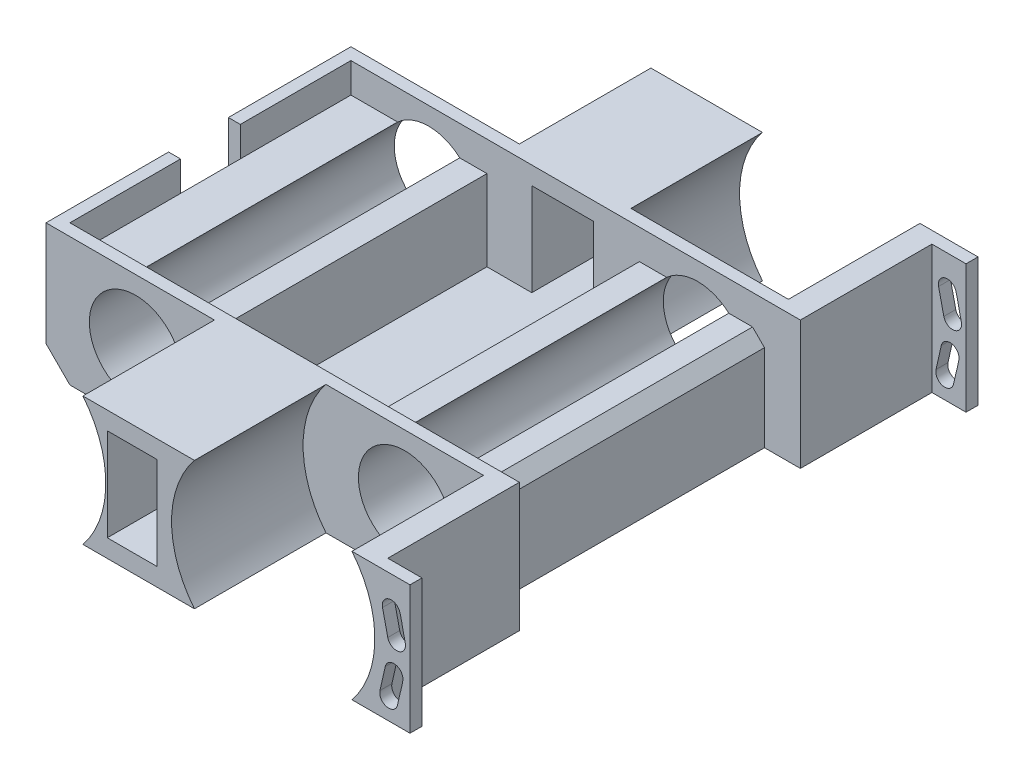
from build123d import *

# Parameters (mm, degrees)
SKETCH1_W           = 95
SKETCH1_H           = 95
BOSS_EXTRUDE1_DEPTH = 25
SKETCH2_R           = 7.75
CUT_EXTRUDE2_DEPTH  = 100
SKETCH3_R           = 17
CUT_EXTRUDE3_DEPTH  = 22
CUT_EXTRUDE4_START  = -22
SKETCH4_R           = 17
CUT_EXTRUDE4_DEPTH  = 22
SKETCH5_W           = 6.246993927
SKETCH5_H           = 25
CUT_EXTRUDE5_DEPTH  = 22
SKETCH6_W           = 7.178723585
SKETCH6_H           = 25
CUT_EXTRUDE6_DEPTH  = 22
SKETCH8_W           = 99.503929421
SKETCH8_H           = 3.5
CUT_EXTRUDE7_DEPTH  = 100
SKETCH9_W           = 8.3
SKETCH9_H           = 15.5
CUT_EXTRUDE11_DEPTH = 100
SKETCH13_W          = 87
SKETCH13_H          = 15.5
CUT_EXTRUDE12_DEPTH = 2
SKETCH14_W          = 25.5
SKETCH14_H          = 47
CUT_EXTRUDE14_DEPTH = 18.5
SKETCH16_W          = 24.75
SKETCH16_H          = 47
CUT_EXTRUDE15_DEPTH = 5
SKETCH17_W          = 20.919567191
SKETCH17_H          = 47
CUT_EXTRUDE16_DEPTH = 5
CUT_EXTRUDE17_DEPTH = 100
FILLET6_R           = 1.5
FILLET7_R           = 1.5
FILLET8_R           = 1.5
FILLET9_R           = 1.5
SKETCH19_W          = 12.12120401
SKETCH19_H          = 21.5
CUT_EXTRUDE20_DEPTH = 100
SKETCH20_W          = 5.709228799
SKETCH20_H          = 91
CUT_EXTRUDE23_DEPTH = 100
SKETCH21_W          = 6
SKETCH21_H          = 47
CUT_EXTRUDE26_DEPTH = 40
CHAMFER1_SIZE       = 2
SKETCH22_W          = 15
SKETCH22_H          = 10
CUT_EXTRUDE27_DEPTH = 4
SKETCH23_W          = 2
SKETCH23_H          = 10
CUT_EXTRUDE28_DEPTH = 54
CHAMFER2_SIZE       = 2
CHAMFER3_SIZE       = 4
CHAMFER4_SIZE       = 4
CUT_EXTRUDE29_DEPTH = 100


with BuildPart() as part:
    # Sketch1 → Boss-Extrude1 (new body)
    with BuildSketch(Plane(origin=(0, 0, 0), x_dir=(1, 0, 0), z_dir=(0, 1, 0))):
        with Locations((3.271948822, -17.506298191)):
            Rectangle(SKETCH1_W, SKETCH1_H)
    extrude(amount=BOSS_EXTRUDE1_DEPTH)

    # Sketch2 → Cut-Extrude2 (cut)
    with BuildSketch(Plane.XY.offset(65.006298191)):
        with Locations((-29.228051178, 10.75)):
            Circle(SKETCH2_R)
        with Locations((15.771948822, 10.75)):
            Circle(SKETCH2_R)
    extrude(amount=-CUT_EXTRUDE2_DEPTH, mode=Mode.SUBTRACT)

    # Sketch3 → Cut-Extrude3 (cut)
    with BuildSketch(Plane.XY.offset(65.006298191)):
        with Locations((-29.228051178, 10.75)):
            Circle(SKETCH3_R)
        with Locations((15.771948822, 10.75)):
            Circle(SKETCH3_R)
    extrude(amount=-CUT_EXTRUDE3_DEPTH, mode=Mode.SUBTRACT)

    # Sketch4 → Cut-Extrude4 (cut)
    with BuildSketch(Plane(origin=(0, 0, -29.993701809), x_dir=(-1, 0, 0), z_dir=(0, 0, -1)).offset(CUT_EXTRUDE4_START)):
        with Locations((-15.771948822, 10.75)):
            Circle(SKETCH4_R)
        with Locations((29.228051178, 10.75)):
            Circle(SKETCH4_R)
    extrude(amount=CUT_EXTRUDE4_DEPTH, mode=Mode.SUBTRACT)

    # Sketch5 → Cut-Extrude5 (cut)
    with BuildSketch(Plane.XY.offset(65.006298191)):
        with Locations((-41.104554214, 12.5)):
            Rectangle(SKETCH5_W, SKETCH5_H)
    extrude(amount=-CUT_EXTRUDE5_DEPTH, mode=Mode.SUBTRACT)

    # Sketch6 → Cut-Extrude6 (cut)
    with BuildSketch(Plane(origin=(0, 0, -29.993701809), x_dir=(-1, 0, 0), z_dir=(0, 0, -1))):
        with Locations((40.638689386, 12.5)):
            Rectangle(SKETCH6_W, SKETCH6_H)
    extrude(amount=-CUT_EXTRUDE6_DEPTH, mode=Mode.SUBTRACT)

    # Sketch8 → Cut-Extrude7 (cut)
    with BuildSketch(Plane(origin=(0, 0, -29.993701809), x_dir=(-1, 0, 0), z_dir=(0, 0, -1))):
        with Locations((-1.019984112, 23.25)):
            Rectangle(SKETCH8_W, SKETCH8_H)
    extrude(amount=-CUT_EXTRUDE7_DEPTH, mode=Mode.SUBTRACT)

    # Sketch9 → Cut-Extrude11 (cut)
    with BuildSketch(Plane.XY.offset(65.006298191)):
        with Locations((-7.828051178, 10.75)):
            Rectangle(SKETCH9_W, SKETCH9_H)
    extrude(amount=-CUT_EXTRUDE11_DEPTH, mode=Mode.SUBTRACT)

    # Sketch13 → Cut-Extrude12 (cut)
    with BuildSketch(Plane.ZY.offset(3.678051178)):
        with Locations((17.506298191, 10.75)):
            Rectangle(SKETCH13_W, SKETCH13_H)
    extrude(amount=-CUT_EXTRUDE12_DEPTH, mode=Mode.SUBTRACT)

    # Sketch14 → Cut-Extrude14 (cut)
    with BuildSketch(Plane(origin=(0, 21.5, 0), x_dir=(1, 0, 0), z_dir=(0, 1, 0))):
        with Locations((-6.728051178, -17.506298191)):
            Rectangle(SKETCH14_W, SKETCH14_H)
    extrude(amount=-CUT_EXTRUDE14_DEPTH, mode=Mode.SUBTRACT)

    # Sketch16 → Cut-Extrude15 (cut)
    with BuildSketch(Plane(origin=(0, 21.5, 0), x_dir=(1, 0, 0), z_dir=(0, 1, 0))):
        with Locations((-29.853051178, -17.506298191)):
            Rectangle(SKETCH16_W, SKETCH16_H)
    extrude(amount=-CUT_EXTRUDE15_DEPTH, mode=Mode.SUBTRACT)

    # Sketch17 → Cut-Extrude16 (cut)
    with BuildSketch(Plane(origin=(0, 21.5, 0), x_dir=(1, 0, 0), z_dir=(0, 1, 0))):
        with Locations((16.481732418, -17.506298191)):
            Rectangle(SKETCH17_W, SKETCH17_H)
    extrude(amount=-CUT_EXTRUDE16_DEPTH, mode=Mode.SUBTRACT)

    # Sketch18 → Cut-Extrude17 (cut)
    with BuildSketch(Plane.XY.offset(65.006298191)):
        with BuildLine():
            Line((34.66639245, 12.75), (37.680851122, 12.75))
            ThreePointArc((37.680851122, 12.75), (37.300376381, 15.28065192), (36.628602437, 17.75))
            Line((36.628602437, 17.75), (33.435470555, 17.75))
            ThreePointArc((33.435470555, 17.75), (34.221100776, 15.291893017), (34.66639245, 12.75))
        make_face()
        with BuildLine():
            Line((34.66639245, 8.75), (37.680851122, 8.75))
            ThreePointArc((37.680851122, 8.75), (37.300376381, 6.21934808), (36.628602437, 3.75))
            Line((36.628602437, 3.75), (33.435470555, 3.75))
            ThreePointArc((33.435470555, 3.75), (34.221100776, 6.208106983), (34.66639245, 8.75))
        make_face()
    extrude(amount=-CUT_EXTRUDE17_DEPTH, mode=Mode.SUBTRACT)

    # Fillet6
    fillet6_edges = [part.edges().sort_by_distance(p)[0] for p in [
        (33.435470555, 17.75, 17.506298191),
        (36.628602437, 17.75, 17.506298191),
    ]]
    fillet(fillet6_edges, radius=FILLET6_R - 0.0001)  # a hair under: the kernel refuses the full size

    # Fillet7
    fillet7_edges = [part.edges().sort_by_distance(p)[0] for p in [
        (37.680851122, 12.75, 17.506298191),
        (34.66639245, 12.75, 17.506298191),
    ]]
    fillet(fillet7_edges, radius=FILLET7_R - 0.0001)  # a hair under: the kernel refuses the full size

    # Fillet8
    fillet8_edges = [part.edges().sort_by_distance(p)[0] for p in [
        (33.435470555, 3.75, 17.506298191),
        (36.628602437, 3.75, 17.506298191),
    ]]
    fillet(fillet8_edges, radius=FILLET8_R - 0.0001)  # a hair under: the kernel refuses the full size

    # Fillet9
    fillet9_edges = [part.edges().sort_by_distance(p)[0] for p in [
        (37.680851122, 8.75, 17.506298191),
        (34.66639245, 8.75, 17.506298191),
    ]]
    fillet(fillet9_edges, radius=FILLET9_R - 0.0001)  # a hair under: the kernel refuses the full size

    # Sketch19 → Cut-Extrude20 (cut)
    with BuildSketch(Plane.XY.offset(65.006298191)):
        with Locations((44.711346817, 10.75)):
            Rectangle(SKETCH19_W, SKETCH19_H)
    extrude(amount=-CUT_EXTRUDE20_DEPTH, mode=Mode.SUBTRACT)

    # Sketch20 → Cut-Extrude23 (cut)
    with BuildSketch(Plane(origin=(0, 21.5, 0), x_dir=(1, 0, 0), z_dir=(0, 1, 0))):
        with Locations((35.796130413, -17.506298191)):
            Rectangle(SKETCH20_W, SKETCH20_H)
    extrude(amount=-CUT_EXTRUDE23_DEPTH, mode=Mode.SUBTRACT)

    # Sketch21 → Cut-Extrude26 (cut)
    with BuildSketch(Plane(origin=(0, 21.5, 0), x_dir=(1, 0, 0), z_dir=(0, 1, 0))):
        with Locations((29.941516013, -17.506298191)):
            Rectangle(SKETCH21_W, SKETCH21_H)
    extrude(amount=-CUT_EXTRUDE26_DEPTH, mode=Mode.SUBTRACT)

    # Chamfer1
    chamfer1_edges = [part.edges().sort_by_distance(p)[0] for p in [
        (26.941516013, 16.5, 17.506298191),
    ]]
    chamfer(chamfer1_edges, length=CHAMFER1_SIZE)

    # Sketch22 → Cut-Extrude27 (cut)
    with BuildSketch(Plane(origin=(0, 0, 0), x_dir=(-1, 0, 0), z_dir=(0, -1, 0))):
        with Locations((34.728051178, -17.506298191)):
            Rectangle(SKETCH22_W, SKETCH22_H)
    extrude(amount=-CUT_EXTRUDE27_DEPTH, mode=Mode.SUBTRACT)

    # Sketch23 → Cut-Extrude28 (cut)
    with BuildSketch(Plane(origin=(0, 0, 0), x_dir=(-1, 0, 0), z_dir=(0, -1, 0))):
        with Locations((43.228051178, -17.506298191)):
            Rectangle(SKETCH23_W, SKETCH23_H)
    extrude(amount=-CUT_EXTRUDE28_DEPTH, mode=Mode.SUBTRACT)

    # Chamfer2
    chamfer2_edges = [part.edges().sort_by_distance(p)[0] for p in [
        (-42.228051178, 4, 17.506298191),
    ]]
    chamfer(chamfer2_edges, length=CHAMFER2_SIZE)

    # Chamfer3
    chamfer3_edges = [part.edges().sort_by_distance(p)[0] for p in [
        (-44.228051178, 0, 2.256298191),
    ]]
    chamfer(chamfer3_edges, length=CHAMFER3_SIZE)

    # Chamfer4
    chamfer4_edges = [part.edges().sort_by_distance(p)[0] for p in [
        (-44.228051178, 0, 32.756298191),
    ]]
    chamfer(chamfer4_edges, length=CHAMFER4_SIZE)

    # Sketch24 → Cut-Extrude29 (cut)
    with BuildSketch(Plane.XY.offset(65.006298191)):
        with BuildLine():
            Line((36.983688261, 16.579680704), (37.862836804, 12.677489289))
            ThreePointArc((37.862836804, 12.677489289), (36.729195727, 10.884486805), (34.936193243, 12.018127881))
            Line((34.936193243, 12.018127881), (34.0570447, 15.920319296))
            ThreePointArc((34.0570447, 15.920319296), (35.190685776, 17.713321781), (36.983688261, 16.579680704))
        make_face()
        with BuildLine():
            Line((37.434280479, 6.920319296), (36.555131936, 3.018127881))
            ThreePointArc((36.555131936, 3.018127881), (34.762129451, 1.884486805), (33.628488375, 3.677489289))
            Line((33.628488375, 3.677489289), (34.507636918, 7.579680704))
            ThreePointArc((34.507636918, 7.579680704), (36.300639403, 8.713321781), (37.434280479, 6.920319296))
        make_face()
    extrude(amount=-CUT_EXTRUDE29_DEPTH, mode=Mode.SUBTRACT)


solid = part.part
